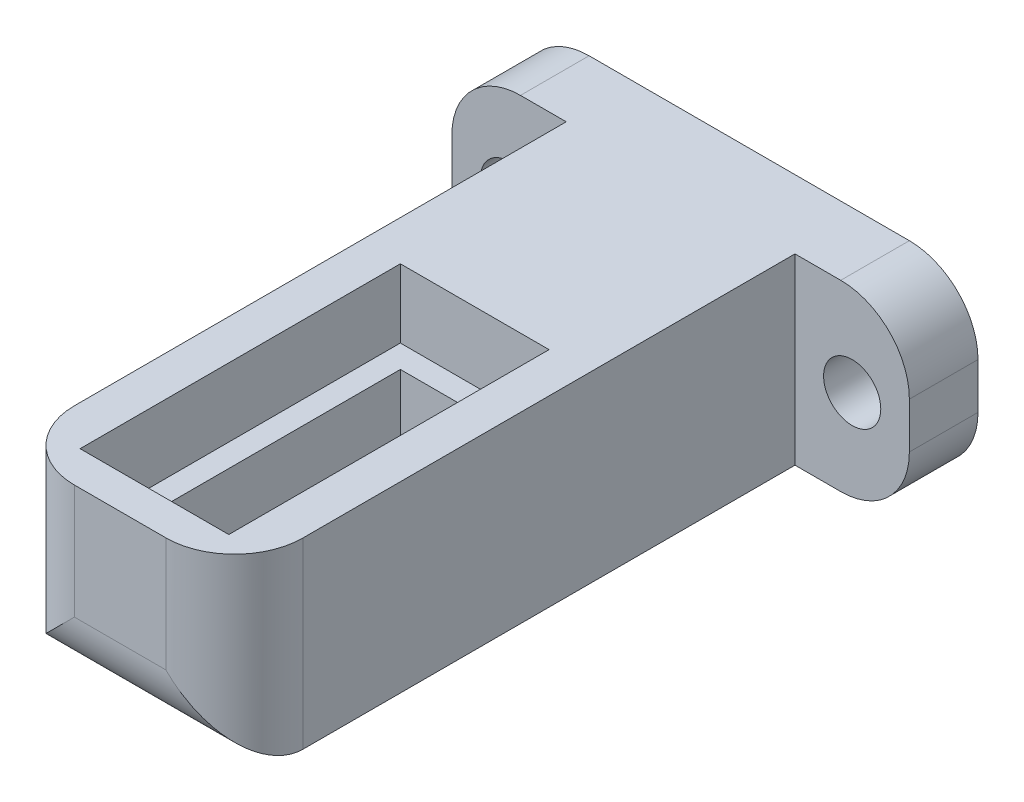
from build123d import *

# Parameters (mm, degrees)
ESBO_O1_W                = 10
ESBO_O1_H                = 27.5
RESSALTO_EXTRUS_O1_DEPTH = 8
ESBO_O2_W                = 6.5
ESBO_O2_H                = 14
CORTE_EXTRUS_O1_DEPTH    = 3
ESBO_O3_W                = 5
ESBO_O3_H                = 8
RESSALTO_EXTRUS_O2_DEPTH = 3
ESBO_O5_R                = 1.25
CORTE_EXTRUS_O2_DEPTH    = 28.645071894
FILETE1_R                = 3
FILETE1_OF_ESPELHAR3_R   = 3
ESBO_O6_W                = 4.5
ESBO_O6_H                = 12
CORTE_EXTRUS_O3_DEPTH    = 3
ESBO_O7_R                = 2
CORTE_EXTRUS_O4_DEPTH    = 19.029489732
FILETE2_R                = 3


with BuildPart() as part:
    # Esboço1 → Ressalto-extrusão1 (new body)
    with BuildSketch(Plane(origin=(0, 0, 0), x_dir=(1, 0, 0), z_dir=(0, 1, 0))):
        Rectangle(ESBO_O1_W, ESBO_O1_H)
    extrude(amount=RESSALTO_EXTRUS_O1_DEPTH)

    # Esboço2 → Corte-extrusão1 (cut)
    with BuildSketch(Plane(origin=(0, 8, 0), x_dir=(1, 0, 0), z_dir=(0, 1, 0))):
        with Locations((0, -5.25)):
            Rectangle(ESBO_O2_W, ESBO_O2_H)
    extrude(amount=-CORTE_EXTRUS_O1_DEPTH, mode=Mode.SUBTRACT)

    # Esboço3 → Ressalto-extrusão2 (add)
    with BuildSketch(Plane(origin=(0, 0, -13.75), x_dir=(-1, 0, 0), z_dir=(0, 0, -1))):
        with Locations((-7.5, 4)):
            Rectangle(ESBO_O3_W, ESBO_O3_H)
    ressalto_extrus_o2 = extrude(amount=-RESSALTO_EXTRUS_O2_DEPTH)

    # Esboço5 → Corte-extrusão2 (cut, through all)
    with BuildSketch(Plane.XY.offset(-10.75)):
        with Locations((7.5, 4)):
            Circle(ESBO_O5_R)
    corte_extrus_o2 = extrude(amount=-CORTE_EXTRUS_O2_DEPTH, mode=Mode.SUBTRACT)

    # Filete1
    filete1_edges = [part.edges().sort_by_distance(p)[0] for p in [
        (10, 0, -12.25),
        (10, 8, -12.25),
    ]]
    fillet(filete1_edges, radius=FILETE1_R)

    # Espelhar3: Ressalto-extrusão2, Corte-extrusão2 across plane
    add(ressalto_extrus_o2.mirror(Plane(origin=(0, 0, 0), x_dir=(0, 0, 1), z_dir=(1, 0, 0))))
    add(corte_extrus_o2.mirror(Plane(origin=(0, 0, 0), x_dir=(0, 0, 1), z_dir=(1, 0, 0))), mode=Mode.SUBTRACT)

    # Filete1 of Espelhar3
    filete1_of_espelhar3_edges = [part.edges().sort_by_distance(p)[0] for p in [
        (-10, 0, -12.25),
        (-10, 8, -12.25),
    ]]
    fillet(filete1_of_espelhar3_edges, radius=FILETE1_OF_ESPELHAR3_R)

    # Esboço6 → Corte-extrusão3 (cut)
    with BuildSketch(Plane(origin=(0, 5, 0), x_dir=(1, 0, 0), z_dir=(0, 1, 0))):
        with Locations((0, -5.25)):
            Rectangle(ESBO_O6_W, ESBO_O6_H)
    extrude(amount=-CORTE_EXTRUS_O3_DEPTH, mode=Mode.SUBTRACT)

    # Esboço7 → Corte-extrusão4 (cut, through all)
    with BuildSketch(Plane(origin=(0, 2, 0), x_dir=(1, 0, 0), z_dir=(0, 1, 0))):
        with Locations((0, -2.25)):
            Circle(ESBO_O7_R)
    extrude(amount=-CORTE_EXTRUS_O4_DEPTH, mode=Mode.SUBTRACT)

    # Filete2
    filete2_edges = [part.edges().sort_by_distance(p)[0] for p in [
        (5, 4, 13.75),
        (-5, 4, 13.75),
        (0, 0, 13.75),
    ]]
    fillet(filete2_edges, radius=FILETE2_R)


solid = part.part
